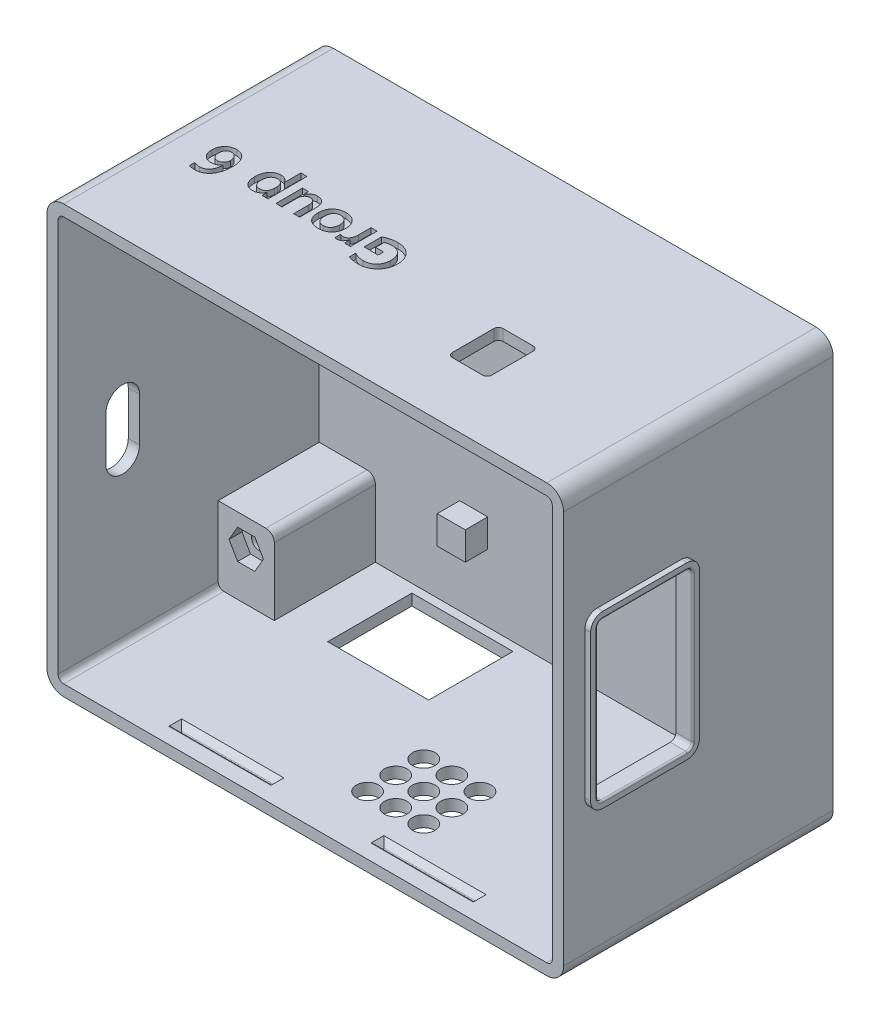
from build123d import *

# Parameters (mm, degrees)
EXTRUDE_1_DEPTH      = 1.5
EXTRUDE_2_DEPTH      = 48
EXTRUDE_5_DEPTH      = 19.5
SKETCH_4_9_R         = 1.35
EXTRUDE_7_DEPTH      = 17.2
CUT_EXTRUDE_1_DEPTH  = 2
CUT_EXTRUDE_2_DEPTH  = 2
SKETCH_17_W          = 18
SKETCH_17_H          = 15
CUT_EXTRUDE_3_DEPTH  = 2.5
SKETCH_12_W          = 20
SKETCH_12_H          = 4
CUT_EXTRUDE_4_DEPTH  = 1.1
CHAMFER_30_SIZE      = 2
CHAMFER_31_SIZE      = 2
CHAMFER_32_SIZE      = 2
CHAMFER_33_SIZE      = 2
FILLET_32_R          = 0.2
FILLET_33_R          = 0.2
FILLET_34_R          = 0.2
FILLET_35_R          = 0.2
SKETCH_18_R          = 2
CUT_EXTRUDE_6_DEPTH  = 3
CUT_EXTRUDE_7_DEPTH  = 5
EXTRUDE_START        = 1
EXTRUDE_8_DEPTH      = 1
FILLET_36_R          = 0.3
CUT_EXTRUDE_14_DEPTH = 1
SKETCH_31_W          = 5
SKETCH_31_H          = 5
EXTRUDE_9_DEPTH      = 4
FILLET_37_R          = 0.3
FILLET_38_R          = 0.3
FILLET_39_R          = 0.3
FILLET_40_R          = 0.3


with BuildPart() as part:
    # 草图1 → 凸台-拉伸1 (new body)
    with BuildSketch(Plane.XY):
        with BuildLine():
            Line((3, 0), (89, 0))
            ThreePointArc((89, 0), (91.121320344, 0.878679656), (92, 3))
            Line((92, 3), (92, 73))
            ThreePointArc((92, 73), (91.121320344, 75.121320344), (89, 76))
            Line((89, 76), (3, 76))
            ThreePointArc((3, 76), (0.878679656, 75.121320344), (0, 73))
            Line((0, 73), (0, 3))
            ThreePointArc((0, 3), (0.878679656, 0.878679656), (3, 0))
        make_face()
    extrude(amount=EXTRUDE_1_DEPTH)

    # 草图3 → 凸台-拉伸2 (add)
    with BuildSketch(Plane.XY):
        with BuildLine():
            Line((3, 0), (89, 0))
            ThreePointArc((89, 0), (91.121320344, 0.878679656), (92, 3))
            Line((92, 3), (92, 73))
            ThreePointArc((92, 73), (91.121320344, 75.121320344), (89, 76))
            Line((89, 76), (3, 76))
            ThreePointArc((3, 76), (0.878679656, 75.121320344), (0, 73))
            Line((0, 73), (0, 3))
            ThreePointArc((0, 3), (0.878679656, 0.878679656), (3, 0))
        make_face()
        with BuildLine():
            Line((2, 3), (2, 73))
            ThreePointArc((2, 73), (2.292893219, 73.707106781), (3, 74))
            Line((3, 74), (89, 74))
            ThreePointArc((89, 74), (89.707106781, 73.707106781), (90, 73))
            Line((90, 73), (90, 3))
            ThreePointArc((90, 3), (89.707106781, 2.292893219), (89, 2))
            Line((89, 2), (3, 2))
            ThreePointArc((3, 2), (2.292893219, 2.292893219), (2, 3))
        make_face(mode=Mode.SUBTRACT)
    extrude(amount=EXTRUDE_2_DEPTH)

    # 草图4 → 凸台-拉伸5 (add)
    # profile 1 of 4: a face of its own
    with BuildSketch(Plane.XY):
        with BuildLine():
            Line((12, 2), (12, 14))
            ThreePointArc((12, 14), (11.560660172, 15.060660172), (10.5, 15.5))
            Line((10.5, 15.5), (2, 15.5))
            Line((2, 15.5), (2, 3))
            ThreePointArc((2, 3), (2.292893219, 2.292893219), (3, 2))
            Line((3, 2), (12, 2))
        make_face()
        Polygon((5.470021787, 13.15), (8.529978213, 13.15), (10.059956427, 10.5), (8.529978213, 7.85), (5.470021787, 7.85), (3.940043573, 10.5), align=None, mode=Mode.SUBTRACT)
    # profile 2 of 4: a face of its own
    with BuildSketch(Plane.XY):
        with BuildLine():
            Line((80, 14), (80, 2))
            Line((80, 2), (89, 2))
            ThreePointArc((89, 2), (89.707106781, 2.292893219), (90, 3))
            Line((90, 3), (90, 15.5))
            Line((90, 15.5), (81.5, 15.5))
            ThreePointArc((81.5, 15.5), (80.439339828, 15.060660172), (80, 14))
        make_face()
        Polygon((83.470021787, 7.85), (81.940043573, 10.5), (83.470021787, 13.15), (86.529978213, 13.15), (88.059956427, 10.5), (86.529978213, 7.85), align=None, mode=Mode.SUBTRACT)
    # profile 3 of 4: a face of its own
    with BuildSketch(Plane.XY):
        with BuildLine():
            Line((2, 73), (2, 63.5))
            Line((2, 63.5), (10.5, 63.5))
            ThreePointArc((10.5, 63.5), (11.560660172, 63.939339828), (12, 65))
            Line((12, 65), (12, 74))
            Line((12, 74), (3, 74))
            ThreePointArc((3, 74), (2.292893219, 73.707106781), (2, 73))
        make_face()
        Polygon((10.059956427, 68.5), (8.529978213, 65.85), (5.470021787, 65.85), (3.940043573, 68.5), (5.470021787, 71.15), (8.529978213, 71.15), align=None, mode=Mode.SUBTRACT)
    # profile 4 of 4: a face of its own
    with BuildSketch(Plane.XY):
        with BuildLine():
            Line((81.5, 63.5), (90, 63.5))
            Line((90, 63.5), (90, 73))
            ThreePointArc((90, 73), (89.707106781, 73.707106781), (89, 74))
            Line((89, 74), (80, 74))
            Line((80, 74), (80, 65))
            ThreePointArc((80, 65), (80.439339828, 63.939339828), (81.5, 63.5))
        make_face()
        Polygon((86.529978213, 71.15), (88.059956427, 68.5), (86.529978213, 65.85), (83.470021787, 65.85), (81.940043573, 68.5), (83.470021787, 71.15), align=None, mode=Mode.SUBTRACT)
    extrude(amount=EXTRUDE_5_DEPTH)

    # 草图4<9> → 凸台-拉伸7 (add)
    # profile 1 of 4: a face of its own
    with BuildSketch(Plane.XY):
        Polygon((86.529978213, 65.85), (83.470021787, 65.85), (81.940043573, 68.5), (83.470021787, 71.15), (86.529978213, 71.15), (88.059956427, 68.5), align=None)
        with Locations(Location((85, 68.5, 0), (0, 0, 180))):
            Circle(SKETCH_4_9_R, mode=Mode.SUBTRACT)
    # profile 2 of 4: a face of its own
    with BuildSketch(Plane.XY):
        Polygon((86.529978213, 13.15), (83.470021787, 13.15), (81.940043573, 10.5), (83.470021787, 7.85), (86.529978213, 7.85), (88.059956427, 10.5), align=None)
        with Locations(Location((85, 10.5, 0), (0, 0, 180))):
            Circle(SKETCH_4_9_R, mode=Mode.SUBTRACT)
    # profile 3 of 4: a face of its own
    with BuildSketch(Plane.XY):
        Polygon((8.529978213, 7.85), (5.470021787, 7.85), (3.940043573, 10.5), (5.470021787, 13.15), (8.529978213, 13.15), (10.059956427, 10.5), align=None)
        with Locations(Location((7, 10.5, 0), (0, 0, 180))):
            Circle(SKETCH_4_9_R, mode=Mode.SUBTRACT)
    # profile 4 of 4: a face of its own
    with BuildSketch(Plane.XY):
        Polygon((3.940043573, 68.5), (5.470021787, 65.85), (8.529978213, 65.85), (10.059956427, 68.5), (8.529978213, 71.15), (5.470021787, 71.15), align=None)
        with Locations(Location((7, 68.5, 0), (0, 0, 180))):
            Circle(SKETCH_4_9_R, mode=Mode.SUBTRACT)
    extrude(amount=EXTRUDE_7_DEPTH)

    # 草图10 → 切除-拉伸1 (cut)
    with BuildSketch(Plane(origin=(92, 0, 0), x_dir=(0, 0, -1), z_dir=(1, 0, 0))):
        with BuildLine():
            Line((-42, 54), (-27, 54))
            ThreePointArc((-27, 54), (-26.292893219, 53.707106781), (-26, 53))
            Line((-26, 53), (-26, 27))
            ThreePointArc((-26, 27), (-26.292893219, 26.292893219), (-27, 26))
            Line((-27, 26), (-42, 26))
            ThreePointArc((-42, 26), (-42.707106781, 26.292893219), (-43, 27))
            Line((-43, 27), (-43, 53))
            ThreePointArc((-43, 53), (-42.707106781, 53.707106781), (-42, 54))
        make_face()
    extrude(amount=-CUT_EXTRUDE_1_DEPTH, mode=Mode.SUBTRACT)

    # 草图11 → 切除-拉伸2 (cut)
    with BuildSketch(Plane.ZY):
        with BuildLine():
            Line((39.5, 38.9), (39.5, 31.1))
            ThreePointArc((39.5, 31.1), (36.5, 28.1), (33.5, 31.1))
            Line((33.5, 31.1), (33.5, 38.9))
            ThreePointArc((33.5, 38.9), (36.5, 41.9), (39.5, 38.9))
        make_face()
    extrude(amount=-CUT_EXTRUDE_2_DEPTH, mode=Mode.SUBTRACT)

    # 草图17 → 切除-拉伸3 (cut)
    with BuildSketch(Plane.XZ):
        with Locations((29, 10.5)):
            Rectangle(SKETCH_17_W, SKETCH_17_H)
    extrude(amount=-CUT_EXTRUDE_3_DEPTH, mode=Mode.SUBTRACT)

    # 草图12 → 切除-拉伸4 (cut)
    with BuildSketch(Plane.XZ.offset(-74)):
        with Locations((28, 44)):
            Rectangle(SKETCH_12_W, SKETCH_12_H)
        with Locations((64, 44)):
            Rectangle(SKETCH_12_W, SKETCH_12_H)
    cut_extrude_4 = extrude(amount=-CUT_EXTRUDE_4_DEPTH, mode=Mode.SUBTRACT)

    # 倒角30
    # the kernel refuses this chamfer: 2 mm, written as the material it adds along each edge
    with BuildSketch(Plane(origin=(12.856634024, 75.1, 46), x_dir=(0, -0.9996219169112968, 0.02749587661058555), z_dir=(1, 0, 0))) as chamfer_30_piece_1_section:
        Polygon((CHAMFER_30_SIZE * 0.999621916911, CHAMFER_30_SIZE * 0.0274958766106), (-CHAMFER_30_SIZE * 0.0274958766106, CHAMFER_30_SIZE * 0.999621916911), (0, 0), align=None)
    chamfer_30_piece_1 = extrude(amount=30.286731952, mode=Mode.PRIVATE)
    chamfer_30_piece_1 = split(chamfer_30_piece_1, bisect_by=Plane(origin=(15.428317012, 74, 45.232135852), z_dir=(0, 1, 0)), keep=Keep.TOP, mode=Mode.PRIVATE)
    add(chamfer_30_piece_1)
    with BuildSketch(Plane(origin=(38, 75.1, 46), x_dir=(0.02749587661058555, -0.9996219169112968, 0), z_dir=(0, 0, -1))) as chamfer_30_piece_2_section:
        Polygon((CHAMFER_30_SIZE * 0.999621916911, CHAMFER_30_SIZE * 0.0274958766106), (-CHAMFER_30_SIZE * 0.0274958766106, CHAMFER_30_SIZE * 0.999621916911), (0, 0), align=None)
    chamfer_30_piece_2 = extrude(amount=9.143365976, mode=Mode.PRIVATE)
    chamfer_30_piece_2 = split(chamfer_30_piece_2, bisect_by=Plane(origin=(37.232135852, 74, 44), z_dir=(0, 1, 0)), keep=Keep.TOP, mode=Mode.PRIVATE)
    add(chamfer_30_piece_2)
    with BuildSketch(Plane(origin=(43.143365976, 75.1, 42), x_dir=(0, -0.9996219169112968, -0.02749587661058555), z_dir=(-1, 0, 0))) as chamfer_30_piece_3_section:
        Polygon((CHAMFER_30_SIZE * 0.999621916911, CHAMFER_30_SIZE * 0.0274958766106), (-CHAMFER_30_SIZE * 0.0274958766106, CHAMFER_30_SIZE * 0.999621916911), (0, 0), align=None)
    chamfer_30_piece_3 = extrude(amount=30.286731952, mode=Mode.PRIVATE)
    chamfer_30_piece_3 = split(chamfer_30_piece_3, bisect_by=Plane(origin=(40.571682988, 74, 42.767864148), z_dir=(0, 1, 0)), keep=Keep.TOP, mode=Mode.PRIVATE)
    add(chamfer_30_piece_3)
    with BuildSketch(Plane(origin=(18, 75.1, 36.856634024), x_dir=(-0.02749587661058555, -0.9996219169112968, 0), z_dir=(0, 0, 1))) as chamfer_30_piece_4_section:
        Polygon((CHAMFER_30_SIZE * 0.999621916911, CHAMFER_30_SIZE * 0.0274958766106), (-CHAMFER_30_SIZE * 0.0274958766106, CHAMFER_30_SIZE * 0.999621916911), (0, 0), align=None)
    chamfer_30_piece_4 = extrude(amount=9.143365976, mode=Mode.PRIVATE)
    chamfer_30_piece_4 = split(chamfer_30_piece_4, bisect_by=Plane(origin=(18.767864148, 74, 39.428317012), z_dir=(0, 1, 0)), keep=Keep.TOP, mode=Mode.PRIVATE)
    add(chamfer_30_piece_4)

    # 倒角31
    # the kernel refuses this chamfer: 2 mm, written as the material it adds along each edge
    with BuildSketch(Plane(origin=(48.856634024, 75.1, 46), x_dir=(0, -0.9996219169112968, 0.02749587661058555), z_dir=(1, 0, 0))) as chamfer_31_piece_1_section:
        Polygon((CHAMFER_31_SIZE * 0.999621916911, CHAMFER_31_SIZE * 0.0274958766106), (-CHAMFER_31_SIZE * 0.0274958766106, CHAMFER_31_SIZE * 0.999621916911), (0, 0), align=None)
    chamfer_31_piece_1 = extrude(amount=30.286731952, mode=Mode.PRIVATE)
    chamfer_31_piece_1 = split(chamfer_31_piece_1, bisect_by=Plane(origin=(51.428317012, 74, 45.232135852), z_dir=(0, 1, 0)), keep=Keep.TOP, mode=Mode.PRIVATE)
    add(chamfer_31_piece_1)
    with BuildSketch(Plane(origin=(74, 75.1, 46), x_dir=(0.027495876610589005, -0.9996219169112968, 0), z_dir=(0, 0, -1))) as chamfer_31_piece_2_section:
        Polygon((CHAMFER_31_SIZE * 0.999621916911, CHAMFER_31_SIZE * 0.0274958766106), (-CHAMFER_31_SIZE * 0.0274958766106, CHAMFER_31_SIZE * 0.999621916911), (0, 0), align=None)
    chamfer_31_piece_2 = extrude(amount=9.143365976, mode=Mode.PRIVATE)
    chamfer_31_piece_2 = split(chamfer_31_piece_2, bisect_by=Plane(origin=(73.232135852, 74, 44), z_dir=(0, 1, 0)), keep=Keep.TOP, mode=Mode.PRIVATE)
    add(chamfer_31_piece_2)
    with BuildSketch(Plane(origin=(79.143365976, 75.1, 42), x_dir=(0, -0.9996219169112968, -0.02749587661058555), z_dir=(-1, 0, 0))) as chamfer_31_piece_3_section:
        Polygon((CHAMFER_31_SIZE * 0.999621916911, CHAMFER_31_SIZE * 0.0274958766106), (-CHAMFER_31_SIZE * 0.0274958766106, CHAMFER_31_SIZE * 0.999621916911), (0, 0), align=None)
    chamfer_31_piece_3 = extrude(amount=30.286731952, mode=Mode.PRIVATE)
    chamfer_31_piece_3 = split(chamfer_31_piece_3, bisect_by=Plane(origin=(76.571682988, 74, 42.767864148), z_dir=(0, 1, 0)), keep=Keep.TOP, mode=Mode.PRIVATE)
    add(chamfer_31_piece_3)
    with BuildSketch(Plane(origin=(54, 75.1, 36.856634024), x_dir=(-0.02749587661058555, -0.9996219169112968, 0), z_dir=(0, 0, 1))) as chamfer_31_piece_4_section:
        Polygon((CHAMFER_31_SIZE * 0.999621916911, CHAMFER_31_SIZE * 0.0274958766106), (-CHAMFER_31_SIZE * 0.0274958766106, CHAMFER_31_SIZE * 0.999621916911), (0, 0), align=None)
    chamfer_31_piece_4 = extrude(amount=9.143365976, mode=Mode.PRIVATE)
    chamfer_31_piece_4 = split(chamfer_31_piece_4, bisect_by=Plane(origin=(54.767864148, 74, 39.428317012), z_dir=(0, 1, 0)), keep=Keep.TOP, mode=Mode.PRIVATE)
    add(chamfer_31_piece_4)

    # 镜向6: 切除-拉伸4 across plane
    add(cut_extrude_4.mirror(Plane(origin=(0, 38, 0), x_dir=(0, 0, 1), z_dir=(0, -1, 0))), mode=Mode.SUBTRACT)

    # 倒角32
    # the kernel refuses this chamfer: 2 mm, written as the material it adds along each edge
    with BuildSketch(Plane(origin=(79.143365976, 0.9, 42), x_dir=(0, 0.9996219169112968, -0.02749587661058563), z_dir=(-1, 0, 0))) as chamfer_32_piece_1_section:
        Polygon((CHAMFER_32_SIZE * 0.999621916911, -CHAMFER_32_SIZE * 0.0274958766106), (-CHAMFER_32_SIZE * 0.0274958766106, -CHAMFER_32_SIZE * 0.999621916911), (0, 0), align=None)
    chamfer_32_piece_1 = extrude(amount=30.286731952, mode=Mode.PRIVATE)
    chamfer_32_piece_1 = split(chamfer_32_piece_1, bisect_by=Plane(origin=(76.571682988, 2, 42.767864148), z_dir=(0, -1, 0)), keep=Keep.TOP, mode=Mode.PRIVATE)
    add(chamfer_32_piece_1)
    with BuildSketch(Plane(origin=(74, 0.9, 46), x_dir=(0.02749587661058908, 0.9996219169112968, 0), z_dir=(0, 0, -1))) as chamfer_32_piece_2_section:
        Polygon((CHAMFER_32_SIZE * 0.999621916911, -CHAMFER_32_SIZE * 0.0274958766106), (-CHAMFER_32_SIZE * 0.0274958766106, -CHAMFER_32_SIZE * 0.999621916911), (0, 0), align=None)
    chamfer_32_piece_2 = extrude(amount=9.143365976, mode=Mode.PRIVATE)
    chamfer_32_piece_2 = split(chamfer_32_piece_2, bisect_by=Plane(origin=(73.232135852, 2, 44), z_dir=(0, -1, 0)), keep=Keep.TOP, mode=Mode.PRIVATE)
    add(chamfer_32_piece_2)
    with BuildSketch(Plane(origin=(48.856634024, 0.9, 46), x_dir=(0, 0.9996219169112968, 0.02749587661058563), z_dir=(1, 0, 0))) as chamfer_32_piece_3_section:
        Polygon((CHAMFER_32_SIZE * 0.999621916911, -CHAMFER_32_SIZE * 0.0274958766106), (-CHAMFER_32_SIZE * 0.0274958766106, -CHAMFER_32_SIZE * 0.999621916911), (0, 0), align=None)
    chamfer_32_piece_3 = extrude(amount=30.286731952, mode=Mode.PRIVATE)
    chamfer_32_piece_3 = split(chamfer_32_piece_3, bisect_by=Plane(origin=(51.428317012, 2, 45.232135852), z_dir=(0, -1, 0)), keep=Keep.TOP, mode=Mode.PRIVATE)
    add(chamfer_32_piece_3)
    with BuildSketch(Plane(origin=(54, 0.9, 36.856634024), x_dir=(-0.02749587661058563, 0.9996219169112968, 0), z_dir=(0, 0, 1))) as chamfer_32_piece_4_section:
        Polygon((CHAMFER_32_SIZE * 0.999621916911, -CHAMFER_32_SIZE * 0.0274958766106), (-CHAMFER_32_SIZE * 0.0274958766106, -CHAMFER_32_SIZE * 0.999621916911), (0, 0), align=None)
    chamfer_32_piece_4 = extrude(amount=9.143365976, mode=Mode.PRIVATE)
    chamfer_32_piece_4 = split(chamfer_32_piece_4, bisect_by=Plane(origin=(54.767864148, 2, 39.428317012), z_dir=(0, -1, 0)), keep=Keep.TOP, mode=Mode.PRIVATE)
    add(chamfer_32_piece_4)

    # 倒角33
    # the kernel refuses this chamfer: 2 mm, written as the material it adds along each edge
    with BuildSketch(Plane(origin=(43.143365976, 0.9, 42), x_dir=(0, 0.9996219169112968, -0.02749587661058563), z_dir=(-1, 0, 0))) as chamfer_33_piece_1_section:
        Polygon((CHAMFER_33_SIZE * 0.999621916911, -CHAMFER_33_SIZE * 0.0274958766106), (-CHAMFER_33_SIZE * 0.0274958766106, -CHAMFER_33_SIZE * 0.999621916911), (0, 0), align=None)
    chamfer_33_piece_1 = extrude(amount=30.286731952, mode=Mode.PRIVATE)
    chamfer_33_piece_1 = split(chamfer_33_piece_1, bisect_by=Plane(origin=(40.571682988, 2, 42.767864148), z_dir=(0, -1, 0)), keep=Keep.TOP, mode=Mode.PRIVATE)
    add(chamfer_33_piece_1)
    with BuildSketch(Plane(origin=(38, 0.9, 46), x_dir=(0.02749587661058563, 0.9996219169112968, 0), z_dir=(0, 0, -1))) as chamfer_33_piece_2_section:
        Polygon((CHAMFER_33_SIZE * 0.999621916911, -CHAMFER_33_SIZE * 0.0274958766106), (-CHAMFER_33_SIZE * 0.0274958766106, -CHAMFER_33_SIZE * 0.999621916911), (0, 0), align=None)
    chamfer_33_piece_2 = extrude(amount=9.143365976, mode=Mode.PRIVATE)
    chamfer_33_piece_2 = split(chamfer_33_piece_2, bisect_by=Plane(origin=(37.232135852, 2, 44), z_dir=(0, -1, 0)), keep=Keep.TOP, mode=Mode.PRIVATE)
    add(chamfer_33_piece_2)
    with BuildSketch(Plane(origin=(12.856634024, 0.9, 46), x_dir=(0, 0.9996219169112968, 0.02749587661058563), z_dir=(1, 0, 0))) as chamfer_33_piece_3_section:
        Polygon((CHAMFER_33_SIZE * 0.999621916911, -CHAMFER_33_SIZE * 0.0274958766106), (-CHAMFER_33_SIZE * 0.0274958766106, -CHAMFER_33_SIZE * 0.999621916911), (0, 0), align=None)
    chamfer_33_piece_3 = extrude(amount=30.286731952, mode=Mode.PRIVATE)
    chamfer_33_piece_3 = split(chamfer_33_piece_3, bisect_by=Plane(origin=(15.428317012, 2, 45.232135852), z_dir=(0, -1, 0)), keep=Keep.TOP, mode=Mode.PRIVATE)
    add(chamfer_33_piece_3)
    with BuildSketch(Plane(origin=(18, 0.9, 36.856634024), x_dir=(-0.02749587661058563, 0.9996219169112968, 0), z_dir=(0, 0, 1))) as chamfer_33_piece_4_section:
        Polygon((CHAMFER_33_SIZE * 0.999621916911, -CHAMFER_33_SIZE * 0.0274958766106), (-CHAMFER_33_SIZE * 0.0274958766106, -CHAMFER_33_SIZE * 0.999621916911), (0, 0), align=None)
    chamfer_33_piece_4 = extrude(amount=9.143365976, mode=Mode.PRIVATE)
    chamfer_33_piece_4 = split(chamfer_33_piece_4, bisect_by=Plane(origin=(18.767864148, 2, 39.428317012), z_dir=(0, -1, 0)), keep=Keep.TOP, mode=Mode.PRIVATE)
    add(chamfer_33_piece_4)

    # 圆角32
    fillet_32_edges = [part.edges().sort_by_distance(p)[0] for p in [
        (28, 0.9, 44),
    ]]
    fillet(fillet_32_edges, radius=FILLET_32_R)

    # 圆角33
    fillet_33_edges = [part.edges().sort_by_distance(p)[0] for p in [
        (64, 0.9, 44),
    ]]
    fillet(fillet_33_edges, radius=FILLET_33_R)

    # 圆角34
    fillet_34_edges = [part.edges().sort_by_distance(p)[0] for p in [
        (64, 75.1, 44),
    ]]
    fillet(fillet_34_edges, radius=FILLET_34_R)

    # 圆角35
    fillet_35_edges = [part.edges().sort_by_distance(p)[0] for p in [
        (28, 75.1, 44),
    ]]
    fillet(fillet_35_edges, radius=FILLET_35_R)

    # 草图18 → 切除-拉伸6 (cut)
    with BuildSketch(Plane.XZ):
        with Locations(Location((46.65, 37.541037588, 0), (0, 0, 270))):
            Circle(SKETCH_18_R)
        with Locations(Location((51.65, 37.541037588, 0), (0, 0, 270))):
            Circle(SKETCH_18_R)
        with Locations(Location((46.65, 32.541037588, 0), (0, 0, 270))):
            Circle(SKETCH_18_R)
        with Locations(Location((56.65, 37.541037588, 0), (0, 0, 270))):
            Circle(SKETCH_18_R)
        with Locations(Location((46.65, 27.541037588, 0), (0, 0, 270))):
            Circle(SKETCH_18_R)
        with Locations(Location((56.65, 32.541037588, 0), (0, 0, 270))):
            Circle(SKETCH_18_R)
        with Locations(Location((51.65, 27.541037588, 0), (0, 0, 270))):
            Circle(SKETCH_18_R)
        with Locations(Location((56.65, 27.541037588, 0), (0, 0, 270))):
            Circle(SKETCH_18_R)
        with Locations(Location((51.65, 32.541037588, 0), (0, 0, 270))):
            Circle(SKETCH_18_R)
    extrude(amount=-CUT_EXTRUDE_6_DEPTH, mode=Mode.SUBTRACT)

    # 草图21 → 切除-拉伸7 (cut)
    with BuildSketch(Plane(origin=(0, 76, 0), x_dir=(1, 0, 0), z_dir=(0, 1, 0))):
        with BuildLine():
            Line((61.3, -28.1), (66.7, -28.1))
            ThreePointArc((66.7, -28.1), (67.265685425, -28.334314575), (67.5, -28.9))
            Line((67.5, -28.9), (67.5, -36.3))
            ThreePointArc((67.5, -36.3), (67.265685425, -36.865685425), (66.7, -37.1))
            Line((66.7, -37.1), (61.3, -37.1))
            ThreePointArc((61.3, -37.1), (60.734314575, -36.865685425), (60.5, -36.3))
            Line((60.5, -36.3), (60.5, -28.9))
            ThreePointArc((60.5, -28.9), (60.734314575, -28.334314575), (61.3, -28.1))
        make_face()
    extrude(amount=-CUT_EXTRUDE_7_DEPTH, mode=Mode.SUBTRACT)

    # 草图27 → 凸台-拉伸8 (add)
    with BuildSketch(Plane(origin=(92, 0, 0), x_dir=(0, 0, -1), z_dir=(1, 0, 0)).offset(EXTRUDE_START)):
        with BuildLine():
            Line((-42, 24.8), (-27, 24.8))
            ThreePointArc((-27, 24.8), (-25.444365081, 25.444365081), (-24.8, 27))
            Line((-24.8, 27), (-24.8, 53))
            ThreePointArc((-24.8, 53), (-25.444365081, 54.555634919), (-27, 55.2))
            Line((-27, 55.2), (-42, 55.2))
            ThreePointArc((-42, 55.2), (-43.555634919, 54.555634919), (-44.2, 53))
            Line((-44.2, 53), (-44.2, 27))
            ThreePointArc((-44.2, 27), (-43.555634919, 25.444365081), (-42, 24.8))
        make_face()
        with BuildLine():
            Line((-27, 54), (-42, 54))
            ThreePointArc((-42, 54), (-42.707106781, 53.707106781), (-43, 53))
            Line((-43, 53), (-43, 27))
            ThreePointArc((-43, 27), (-42.707106781, 26.292893219), (-42, 26))
            Line((-42, 26), (-27, 26))
            ThreePointArc((-27, 26), (-26.292893219, 26.292893219), (-26, 27))
            Line((-26, 27), (-26, 53))
            ThreePointArc((-26, 53), (-26.292893219, 53.707106781), (-27, 54))
        make_face(mode=Mode.SUBTRACT)
    extrude(amount=-EXTRUDE_8_DEPTH)

    # 圆角36
    fillet_36_edges = [part.edges().sort_by_distance(p)[0] for p in [
        (93, 26.292893219, 26.292893219),
        (93, 40, 26),
        (93, 53.707106781, 26.292893219),
        (93, 54, 34.5),
        (93, 53.707106781, 42.707106781),
        (93, 40, 43),
        (93, 26.292893219, 42.707106781),
        (93, 26, 34.5),
    ]]
    fillet(fillet_36_edges, radius=FILLET_36_R)

    # 草图30 → 切除-拉伸14 (cut)
    # profile 1 of 6: a face of its own
    with BuildSketch(Plane(origin=(0, 76, 0), x_dir=(1, 0, 0), z_dir=(0, 1, 0))):
        with BuildLine():
            add(Edge.make_bspline(
                [(7.837725459, -26.451702353), (7.839231395, -26.370127134), (7.842187568, -26.209993911), (7.875495868, -25.975784287), (7.9254127, -25.752108194), (7.996956665, -25.540027795), (8.088243661, -25.341303685), (8.193379509, -25.154656374), (8.316790428, -24.983793561), (8.454284076, -24.826637104), (8.606681881, -24.684281132), (8.775335908, -24.561114532), (8.956202981, -24.452991886), (9.150003974, -24.362966541), (9.354063062, -24.289220575), (9.568893712, -24.239555282), (9.791181651, -24.206179605), (9.942664393, -24.203118841), (10.019212263, -24.201572163)],
                knots=[0, 0, 0, 0, 1.114728793, 2.188227203, 3.228076612, 4.245215034, 5.242152729, 6.214694322, 7.169826888, 8.118769181, 9.066348733, 10.015043401, 10.969109421, 11.943320545, 12.932945183, 13.930138159, 14.954049072, 16, 16, 16, 16], degree=3))
            add(Edge.make_bspline(
                [(10.019212263, -24.201572163), (10.101248251, -24.204007168), (10.262454513, -24.208792116), (10.499414043, -24.244808815), (10.725271859, -24.307067628), (10.940706102, -24.392722466), (11.144907751, -24.500668382), (11.33396555, -24.635149086), (11.507918291, -24.793316995), (11.667951947, -24.973683324), (11.810856776, -25.178553461), (11.93803679, -25.406388887), (12.045076072, -25.65876895), (12.137956499, -25.932855484), (12.209451856, -26.230244181), (12.263973661, -26.550204532), (12.29274143, -26.893694586), (12.297233621, -27.130309543), (12.299545542, -27.252084233)],
                knots=[0, 0, 0, 0, 0.917785828, 1.803511187, 2.674367914, 3.533995913, 4.393089911, 5.252687405, 6.122806086, 7.018833661, 7.945123086, 8.912525681, 9.933228562, 11.008480187, 12.147389292, 13.352090246, 14.637244262, 16, 16, 16, 16], degree=3))
            add(Edge.make_bspline(
                [(12.299545542, -27.252084233), (12.297000062, -27.400902802), (12.292039772, -27.690900464), (12.251020596, -28.112794581), (12.180886748, -28.508762913), (12.085446883, -28.877901945), (11.965973945, -29.22004631), (11.824900474, -29.533360809), (11.663887707, -29.819188703), (11.481408527, -30.074970731), (11.279345344, -30.301329389), (11.06235573, -30.501313356), (10.825252543, -30.669241033), (10.573796725, -30.809860909), (10.308614835, -30.920551839), (10.0311425, -30.996308776), (9.74423435, -31.047428987), (9.548543997, -31.052407399), (9.44947216, -31.054927812)],
                knots=[0, 0, 0, 0, 1.341402564, 2.613945368, 3.816495234, 4.963196911, 6.047434463, 7.079561533, 8.056907809, 9.000227372, 9.90605979, 10.787978153, 11.6545661, 12.518872876, 13.380773975, 14.237595208, 15.107750182, 16, 16, 16, 16], degree=3))
            add(Edge.make_bspline(
                [(9.44947216, -31.054927812), (9.388597163, -31.054503576), (9.269054794, -31.053670487), (9.094054304, -31.044124972), (8.926974821, -31.027233399), (8.769759732, -31.006080591), (8.623933324, -30.978945561), (8.492887658, -30.946234195), (8.376422984, -30.910017044), (8.30611898, -30.879758717), (8.272924525, -30.865472067)],
                knots=[0, 0, 0, 0, 1.217696655, 2.391233695, 3.504371771, 4.576356939, 5.563864047, 6.46975115, 7.277483882, 8, 8, 8, 8], degree=3))
            Line((8.272924525, -30.865472067), (8.272924525, -29.903091797))
            add(Edge.make_bspline(
                [(8.272924525, -29.903091797), (8.353847257, -29.939608338), (8.518029876, -30.013696065), (8.734387994, -30.087538141), (8.918820995, -30.133545269), (9.068978992, -30.157683074), (9.228578555, -30.173079028), (9.338232696, -30.175201994), (9.394557451, -30.176292473)],
                knots=[0, 0, 0, 0, 1.371310968, 2.782227202, 3.524793152, 4.305945702, 5.129835019, 6, 6, 6, 6], degree=3))
            add(Edge.make_bspline(
                [(9.394557451, -30.176292473), (9.458269605, -30.174482004), (9.583620872, -30.170919975), (9.768071168, -30.141598479), (9.943984926, -30.091477379), (10.113371451, -30.024643926), (10.271816317, -29.935854304), (10.421952553, -29.831747728), (10.558082001, -29.706402181), (10.683679892, -29.564570087), (10.796476329, -29.40411356), (10.896694002, -29.225968394), (10.984740078, -29.030348896), (11.058411364, -28.816563716), (11.118925062, -28.585883945), (11.1626535, -28.338005017), (11.188233278, -28.073582812), (11.19320421, -27.89189571), (11.195759897, -27.798485585)],
                knots=[0, 0, 0, 0, 0.91345473, 1.797187828, 2.669884559, 3.532777489, 4.402309398, 5.269062608, 6.147196755, 7.049262513, 7.981620723, 8.954451378, 9.976726088, 11.054007273, 12.193831509, 13.393749127, 14.660057773, 16, 16, 16, 16], degree=3))
            Line((11.195759897, -27.798485585), (11.168302543, -27.798485585))
            add(Edge.make_bspline(
                [(11.168302543, -27.798485585), (11.131239818, -27.851296346), (11.057133069, -27.956891223), (10.920651505, -28.096052349), (10.765146681, -28.217526958), (10.592492162, -28.322246292), (10.40139291, -28.405112212), (10.193648754, -28.463712851), (9.970138411, -28.499995678), (9.815711816, -28.50454757), (9.736401513, -28.506885327)],
                knots=[0, 0, 0, 0, 0.927131133, 1.85379449, 2.791689413, 3.76059972, 4.751457081, 5.778941232, 6.859310183, 8, 8, 8, 8], degree=3))
            add(Edge.make_bspline(
                [(9.736401513, -28.506885327), (9.665356764, -28.505688776), (9.526818033, -28.503355477), (9.324409486, -28.47385108), (9.132191044, -28.431563811), (8.951292288, -28.368709038), (8.781668707, -28.291366772), (8.626137477, -28.194775044), (8.480359591, -28.087050435), (8.349858003, -27.960843739), (8.232113796, -27.820518346), (8.131092747, -27.663636), (8.040809774, -27.494375829), (7.966777185, -27.309817726), (7.910134496, -27.111762832), (7.866819563, -26.902199147), (7.842348655, -26.680640361), (7.839288408, -26.529098712), (7.837725459, -26.451702353)],
                knots=[0, 0, 0, 0, 1.077569448, 2.101282756, 3.098925121, 4.06115902, 5.0029132, 5.922683519, 6.835501741, 7.749376711, 8.671740557, 9.610080852, 10.576518415, 11.580141092, 12.622169819, 13.699828833, 14.825241299, 16, 16, 16, 16], degree=3))
        make_face()
        with BuildLine():
            add(Edge.make_bspline(
                [(8.920918088, -26.35148301), (8.921713668, -26.398181053), (8.923268751, -26.489459486), (8.935306908, -26.62357557), (8.9580544, -26.750788112), (8.98551314, -26.872114286), (9.024882693, -26.985211271), (9.070623635, -27.09098372), (9.126668748, -27.188014549), (9.189229675, -27.277822012), (9.262126317, -27.358277937), (9.345802703, -27.426323425), (9.435467305, -27.488075024), (9.535007777, -27.539017601), (9.643926648, -27.578616457), (9.761321848, -27.607135616), (9.887281162, -27.625777219), (9.974295242, -27.627408114), (10.019212263, -27.628249988)],
                knots=[0, 0, 0, 0, 1.171909217, 2.290674915, 3.374409661, 4.413409255, 5.408512558, 6.375177489, 7.301074568, 8.215577101, 9.117883784, 10.0148394, 10.916268638, 11.845932865, 12.812393116, 13.817912492, 14.873597588, 16, 16, 16, 16], degree=3))
            add(Edge.make_bspline(
                [(10.019212263, -27.628249988), (10.064096991, -27.626691142), (10.151934674, -27.62364054), (10.279418613, -27.606970416), (10.397697997, -27.5739943), (10.508139716, -27.532157609), (10.609165203, -27.477603468), (10.703441266, -27.417889901), (10.787810585, -27.348320116), (10.86345707, -27.271228779), (10.930540558, -27.187185542), (10.990467715, -27.097735978), (11.039480672, -27.001604289), (11.09211863, -26.867188362), (11.140515752, -26.692391704), (11.147153353, -26.548161859), (11.150455262, -26.476413972)],
                knots=[0, 0, 0, 0, 1.04389482, 2.042861946, 2.979623477, 3.892337154, 4.782197976, 5.643822534, 6.482888779, 7.317898928, 8.150262014, 8.979355577, 9.81673417, 10.652353988, 12.334696086, 14, 14, 14, 14], degree=3))
            add(Edge.make_bspline(
                [(11.150455262, -26.476413972), (11.147230589, -26.396999934), (11.140643448, -26.234778428), (11.096565358, -26.03413919), (11.046533147, -25.8753233), (10.999925772, -25.759298478), (10.943426333, -25.648997617), (10.877374242, -25.54497379), (10.803836273, -25.446867533), (10.719482854, -25.358446751), (10.625059515, -25.279974319), (10.522480132, -25.209500317), (10.409313995, -25.150583177), (10.284578096, -25.109979179), (10.150208748, -25.084554886), (10.057313297, -25.081682672), (10.009602189, -25.080207503)],
                knots=[0, 0, 0, 0, 1.658502323, 3.387873839, 4.271058063, 5.137724898, 5.997451292, 6.857124491, 7.710229292, 8.555795781, 9.404385631, 10.271790907, 11.152901439, 12.060197367, 13.003717276, 14, 14, 14, 14], degree=3))
            add(Edge.make_bspline(
                [(10.009602189, -25.080207503), (9.966950126, -25.080938965), (9.883469321, -25.08237062), (9.762219855, -25.103060293), (9.647570924, -25.132117593), (9.541676521, -25.175531947), (9.443448333, -25.227653576), (9.353602561, -25.289860461), (9.271974401, -25.361682384), (9.199325823, -25.443204867), (9.134490355, -25.532235066), (9.07953141, -25.630570569), (9.029712611, -25.735055592), (8.990773197, -25.848156546), (8.958522284, -25.966339986), (8.937385664, -26.090509094), (8.922810558, -26.219339355), (8.921554411, -26.307051154), (8.920918088, -26.35148301)],
                knots=[0, 0, 0, 0, 1.084422265, 2.122486895, 3.122800693, 4.089794635, 5.02793783, 5.948926211, 6.865112935, 7.789043778, 8.723490771, 9.662718316, 10.652941449, 11.666196107, 12.703279733, 13.768190844, 14.869440339, 16, 16, 16, 16], degree=3))
        make_face(mode=Mode.SUBTRACT)
    # profile 2 of 6: a face of its own
    with BuildSketch(Plane(origin=(0, 76, 0), x_dir=(1, 0, 0), z_dir=(0, 1, 0))):
        with BuildLine():
            Line((19.325882524, -25.039021471), (19.343729804, -25.039021471))
            Line((19.343729804, -25.039021471), (19.343729804, -22.092847348))
            Line((19.343729804, -22.092847348), (20.418685227, -22.092847348))
            Line((20.418685227, -22.092847348), (20.418685227, -29.034066531))
            Line((20.418685227, -29.034066531), (19.343729804, -29.034066531))
            Line((19.343729804, -29.034066531), (19.343729804, -28.155431191))
            Line((19.343729804, -28.155431191), (19.325882524, -28.155431191))
            add(Edge.make_bspline(
                [(19.325882524, -28.155431191), (19.279228724, -28.232210789), (19.188470165, -28.38157495), (19.024612068, -28.579307392), (18.845321492, -28.747176248), (18.649966616, -28.884649461), (18.438441543, -28.992258889), (18.210163156, -29.067102181), (17.966354374, -29.11383135), (17.798553831, -29.119190241), (17.712762955, -29.121930065)],
                knots=[0, 0, 0, 0, 1.087937529, 2.116433017, 3.101648893, 4.057389971, 5.002624612, 5.96746697, 6.960832977, 8, 8, 8, 8], degree=3))
            add(Edge.make_bspline(
                [(17.712762955, -29.121930065), (17.639425944, -29.120318163), (17.496213244, -29.117170436), (17.287891218, -29.085813416), (17.092021371, -29.037207079), (16.908877425, -28.967574254), (16.737296366, -28.879769471), (16.578771203, -28.770646639), (16.433192396, -28.641065713), (16.300524345, -28.49326059), (16.182816164, -28.32783028), (16.079535012, -28.149129625), (15.992642912, -27.956306353), (15.921426965, -27.750463328), (15.866897076, -27.53072234), (15.827146382, -27.29858591), (15.803750202, -27.052582665), (15.800602966, -26.884206623), (15.798985356, -26.797665018)],
                knots=[0, 0, 0, 0, 1.03437162, 2.019923519, 2.966065333, 3.877718498, 4.778971363, 5.680085363, 6.586000907, 7.523572761, 8.477092696, 9.446427435, 10.432085142, 11.457444532, 12.516366817, 13.623831319, 14.778701243, 16, 16, 16, 16], degree=3))
            add(Edge.make_bspline(
                [(15.798985356, -26.797665018), (15.800230227, -26.701943617), (15.802665887, -26.514659368), (15.831461056, -26.241836469), (15.874266446, -25.982659144), (15.937547912, -25.738974311), (16.017332466, -25.509154102), (16.114365512, -25.293745516), (16.232033476, -25.094460121), (16.364735328, -24.909657978), (16.514000116, -24.744041406), (16.676848576, -24.598139645), (16.853716435, -24.475607594), (17.042712883, -24.374181497), (17.245648974, -24.297537516), (17.460756835, -24.240659963), (17.689775918, -24.207662486), (17.846741079, -24.20363149), (17.926930319, -24.201572163)],
                knots=[0, 0, 0, 0, 1.213889653, 2.375042679, 3.476488291, 4.54385188, 5.56472972, 6.559809165, 7.535614661, 8.496013796, 9.441504295, 10.358528091, 11.263639099, 12.164887555, 13.072731554, 14.009177346, 14.982942744, 16, 16, 16, 16], degree=3))
            add(Edge.make_bspline(
                [(17.926930319, -24.201572163), (18.000761701, -24.204337119), (18.144883633, -24.209734427), (18.354582346, -24.248184147), (18.549936077, -24.315363419), (18.73368953, -24.406326315), (18.903556753, -24.525740233), (19.059454958, -24.672076867), (19.203858977, -24.842950967), (19.284458483, -24.972460282), (19.325882524, -25.039021471)],
                knots=[0, 0, 0, 0, 1.033447623, 2.017332805, 2.971569682, 3.917056367, 4.878577601, 5.866812548, 6.903650321, 8, 8, 8, 8], degree=3))
        make_face()
        with BuildLine():
            Line((19.353339878, -26.858071198), (19.353339878, -26.285585359))
            add(Edge.make_bspline(
                [(19.353339878, -26.285585359), (19.352172914, -26.24436178), (19.349870027, -26.163011093), (19.334999513, -26.043346957), (19.308387074, -25.929130694), (19.273306036, -25.818999838), (19.223867616, -25.715312181), (19.168351368, -25.614098603), (19.10047087, -25.518895991), (19.022090356, -25.430858521), (18.938109379, -25.347892282), (18.845776148, -25.277047562), (18.749108036, -25.215737322), (18.64650522, -25.165791998), (18.537730296, -25.127477666), (18.423607548, -25.100281744), (18.304073226, -25.083117356), (18.222614293, -25.081192795), (18.180910847, -25.080207503)],
                knots=[0, 0, 0, 0, 1.053863336, 2.079695817, 3.075748431, 4.048657304, 5.027455849, 6.00688333, 6.99687248, 8.008195337, 9.017486472, 10.009615842, 10.976811423, 11.939468817, 12.919943627, 13.918671686, 14.93445003, 16, 16, 16, 16], degree=3))
            add(Edge.make_bspline(
                [(18.180910847, -25.080207503), (18.13229738, -25.081283836), (18.037290415, -25.083387351), (17.899499697, -25.106874471), (17.769040299, -25.140051804), (17.646945918, -25.190465547), (17.532808701, -25.254738801), (17.42750709, -25.334544822), (17.329545636, -25.426754218), (17.240510269, -25.532885917), (17.16027978, -25.651285593), (17.092668953, -25.782359862), (17.032535212, -25.923291368), (16.985162797, -26.076121044), (16.948046652, -26.240004427), (16.922744468, -26.415390762), (16.905649617, -26.601465676), (16.90374536, -26.729438804), (16.902771001, -26.794919283)],
                knots=[0, 0, 0, 0, 0.966522016, 1.888907113, 2.774821579, 3.640800831, 4.509553672, 5.37481417, 6.263953297, 7.18174019, 8.126517397, 9.104303226, 10.112498108, 11.172554105, 12.283954689, 13.453544563, 14.697045812, 16, 16, 16, 16], degree=3))
            add(Edge.make_bspline(
                [(16.902771001, -26.794919283), (16.904029702, -26.84985842), (16.906488095, -26.95716107), (16.91965519, -27.113702959), (16.943888794, -27.261266022), (16.980597177, -27.398952563), (17.023304845, -27.528840715), (17.078836842, -27.648564063), (17.14326392, -27.759259675), (17.218088126, -27.859369754), (17.2992048, -27.950983639), (17.391773885, -28.026966342), (17.487244994, -28.096486438), (17.593221008, -28.148928151), (17.704401431, -28.192968365), (17.823966282, -28.21999546), (17.94906062, -28.241247598), (18.035286332, -28.242602716), (18.079318636, -28.243294725)],
                knots=[0, 0, 0, 0, 1.251506559, 2.444340742, 3.575319154, 4.652317473, 5.687338566, 6.68543322, 7.652568213, 8.599036514, 9.528769266, 10.430983402, 11.32162283, 12.212018248, 13.116036934, 14.038790361, 14.998482272, 16, 16, 16, 16], degree=3))
            add(Edge.make_bspline(
                [(18.079318636, -28.243294725), (18.126039898, -28.241766316), (18.217535652, -28.238773182), (18.351674789, -28.221475628), (18.477874919, -28.189290432), (18.598053462, -28.146890408), (18.710033072, -28.090287655), (18.816252379, -28.022202364), (18.914521366, -27.941258686), (19.005164058, -27.848850758), (19.087087181, -27.747804927), (19.159259517, -27.639257853), (19.217624324, -27.522882188), (19.267658422, -27.401997326), (19.306280972, -27.274645973), (19.333364215, -27.141353281), (19.350383031, -27.001746761), (19.352340555, -26.906629115), (19.353339878, -26.858071198)],
                knots=[0, 0, 0, 0, 1.062557445, 2.080840463, 3.067536494, 4.018702425, 4.972596044, 5.913462713, 6.881997822, 7.860541022, 8.851779902, 9.835839173, 10.817695734, 11.806966784, 12.807554105, 13.838043323, 14.896312951, 16, 16, 16, 16], degree=3))
        make_face(mode=Mode.SUBTRACT)
    # profile 3 of 6: a face of its own
    with BuildSketch(Plane(origin=(0, 76, 0), x_dir=(1, 0, 0), z_dir=(0, 1, 0))):
        with BuildLine():
            Line((21.816264564, -24.289435697), (22.891219987, -24.289435697))
            Line((22.891219987, -24.289435697), (22.891219987, -25.089817577))
            Line((22.891219987, -25.089817577), (22.910440135, -25.089817577))
            add(Edge.make_bspline(
                [(22.910440135, -25.089817577), (22.950241661, -25.019068703), (23.027482389, -24.881770084), (23.171120672, -24.700341731), (23.329862849, -24.545791848), (23.505896923, -24.419785055), (23.697736524, -24.32095253), (23.905838316, -24.250660073), (24.13062377, -24.208934416), (24.285872833, -24.204071821), (24.365679917, -24.201572163)],
                knots=[0, 0, 0, 0, 1.079790101, 2.095491884, 3.06967305, 4.021947572, 4.967861457, 5.933520445, 6.937708841, 8, 8, 8, 8], degree=3))
            add(Edge.make_bspline(
                [(24.365679917, -24.201572163), (24.433479422, -24.203161726), (24.5653773, -24.206254079), (24.756515672, -24.2299035), (24.935179168, -24.267774237), (25.100773135, -24.322456279), (25.252762406, -24.394207505), (25.391362161, -24.481534089), (25.517675512, -24.583865722), (25.630479343, -24.702593678), (25.730296019, -24.83705728), (25.815274929, -24.987667483), (25.886436409, -25.153673469), (25.945458476, -25.334726816), (25.992078823, -25.531658605), (26.024340397, -25.744699696), (26.043439045, -25.973136293), (26.0460814, -26.130413499), (26.047442871, -26.211450503)],
                knots=[0, 0, 0, 0, 1.084650296, 2.110090225, 3.076714774, 4.002971594, 4.893937254, 5.759411374, 6.618292969, 7.488432252, 8.373025701, 9.291288001, 10.248967678, 11.258598233, 12.334935959, 13.48348041, 14.70336451, 16, 16, 16, 16], degree=3))
            Line((26.047442871, -26.211450503), (26.047442871, -29.034066531))
            Line((26.047442871, -29.034066531), (24.972487448, -29.034066531))
            Line((24.972487448, -29.034066531), (24.972487448, -26.343245804))
            add(Edge.make_bspline(
                [(24.972487448, -26.343245804), (24.971602062, -26.292432603), (24.969877028, -26.193431146), (24.959304205, -26.0498645), (24.940302175, -25.915855426), (24.912926988, -25.792459168), (24.878550512, -25.678438101), (24.836712542, -25.574069714), (24.785315072, -25.480099744), (24.727513467, -25.39577203), (24.662558444, -25.32016189), (24.588370413, -25.255694491), (24.505949333, -25.202250673), (24.417570619, -25.155323362), (24.319929589, -25.122536258), (24.215386314, -25.096618421), (24.102849069, -25.084011888), (24.025230434, -25.081497777), (23.985395559, -25.080207503)],
                knots=[0, 0, 0, 0, 1.331982066, 2.595155638, 3.770771735, 4.87669833, 5.905024676, 6.889602643, 7.818224664, 8.70661772, 9.565361835, 10.424105951, 11.272482554, 12.136238837, 13.039171002, 13.964377818, 14.955292694, 16, 16, 16, 16], degree=3))
            add(Edge.make_bspline(
                [(23.985395559, -25.080207503), (23.946437211, -25.081214221), (23.869990141, -25.083189682), (23.757712021, -25.100222587), (23.651083388, -25.127562684), (23.548909496, -25.164743393), (23.452782122, -25.214493218), (23.362137421, -25.275435202), (23.275760793, -25.345834463), (23.197037277, -25.427839155), (23.126409147, -25.518647871), (23.061467594, -25.614706486), (23.010830334, -25.720030828), (22.965053404, -25.830264982), (22.933855752, -25.948753264), (22.907876129, -26.072733802), (22.895020515, -26.203864171), (22.892506346, -26.293344937), (22.891219987, -26.3391272)],
                knots=[0, 0, 0, 0, 0.999127095, 1.960564145, 2.906023723, 3.819897251, 4.744121092, 5.675477313, 6.618089225, 7.597919477, 8.584480182, 9.567961814, 10.565639047, 11.577312711, 12.625659834, 13.703317052, 14.82491679, 16, 16, 16, 16], degree=3))
            Line((22.891219987, -26.3391272), (22.891219987, -29.034066531))
            Line((22.891219987, -29.034066531), (21.816264564, -29.034066531))
            Line((21.816264564, -29.034066531), (21.816264564, -24.289435697))
        make_face()
    # profile 4 of 6: a face of its own
    with BuildSketch(Plane(origin=(0, 76, 0), x_dir=(1, 0, 0), z_dir=(0, 1, 0))):
        with BuildLine():
            add(Edge.make_bspline(
                [(29.474120696, -24.201572163), (29.563472515, -24.203042182), (29.738191634, -24.205916665), (29.992873613, -24.239342548), (30.234398316, -24.288165517), (30.46081779, -24.362780758), (30.675169229, -24.453267858), (30.873488372, -24.569511233), (31.060673328, -24.702002979), (31.229885404, -24.858077198), (31.383359621, -25.028797142), (31.518348158, -25.214121566), (31.630201938, -25.414377734), (31.72499438, -25.626559419), (31.795809253, -25.852998416), (31.84614616, -26.092528285), (31.879008067, -26.345080577), (31.88198488, -26.518410039), (31.883503541, -26.606836406)],
                knots=[0, 0, 0, 0, 1.115983566, 2.182201405, 3.205206547, 4.190937343, 5.156704915, 6.107298085, 7.05804609, 8.017544309, 8.977451536, 9.923560751, 10.87628499, 11.839101368, 12.823088461, 13.834905153, 14.895447613, 16, 16, 16, 16], degree=3))
            add(Edge.make_bspline(
                [(31.883503541, -26.606836406), (31.881389433, -26.703020445), (31.877280067, -26.889981301), (31.845567993, -27.162539753), (31.791678473, -27.41871995), (31.719210544, -27.660351789), (31.61966012, -27.883710769), (31.503559757, -28.092902507), (31.363789339, -28.285050345), (31.20250332, -28.458967096), (31.024714191, -28.616048687), (30.829222019, -28.750412709), (30.621360697, -28.867296507), (30.397116856, -28.960382856), (30.15844638, -29.033174307), (29.904808713, -29.085345643), (29.636376797, -29.115192445), (29.452686004, -29.119651168), (29.358799807, -29.121930065)],
                knots=[0, 0, 0, 0, 1.143824117, 2.223345344, 3.257727174, 4.254538702, 5.217243482, 6.160378323, 7.095564194, 8.035426655, 8.976517592, 9.911117243, 10.851594142, 11.807861419, 12.792668405, 13.815283976, 14.883369844, 16, 16, 16, 16], degree=3))
            add(Edge.make_bspline(
                [(29.358799807, -29.121930065), (29.268560911, -29.120278679), (29.092582043, -29.117058237), (28.83662519, -29.086447024), (28.595706563, -29.035847819), (28.370321747, -28.964606474), (28.159665226, -28.873783211), (27.964689359, -28.762021999), (27.785614416, -28.629198764), (27.621186378, -28.4781568), (27.476228814, -28.307315714), (27.348743464, -28.121404448), (27.24303774, -27.918547784), (27.154477289, -27.701441311), (27.088102174, -27.467285701), (27.038359668, -27.218608514), (27.00962065, -26.953931848), (27.006124006, -26.772564796), (27.004331671, -26.679598395)],
                knots=[0, 0, 0, 0, 1.124362069, 2.192668287, 3.207323553, 4.188646195, 5.13382991, 6.061328194, 6.983091241, 7.907409631, 8.837884658, 9.769704845, 10.711181097, 11.683511284, 12.687157073, 13.739771114, 14.841435946, 16, 16, 16, 16], degree=3))
            add(Edge.make_bspline(
                [(27.004331671, -26.679598395), (27.006430957, -26.587980144), (27.010527106, -26.409213609), (27.042736989, -26.148260604), (27.094936867, -25.901115575), (27.166470628, -25.667198909), (27.262872348, -25.448348687), (27.378249187, -25.242900218), (27.514569515, -25.051092286), (27.671764033, -24.875524006), (27.845162468, -24.716058044), (28.035646548, -24.578187576), (28.241022896, -24.462382815), (28.459594635, -24.365763273), (28.693010569, -24.291549666), (28.940526803, -24.240004098), (29.202358338, -24.207748599), (29.382042218, -24.203664862), (29.474120696, -24.201572163)],
                knots=[0, 0, 0, 0, 1.113387789, 2.172454471, 3.19032948, 4.180843377, 5.139869047, 6.091315159, 7.040563614, 7.994007627, 8.950772202, 9.898748577, 10.845353108, 11.811706805, 12.798590485, 13.816465494, 14.881054143, 16, 16, 16, 16], degree=3))
        make_face()
        with BuildLine():
            add(Edge.make_bspline(
                [(29.42332459, -28.243294725), (29.474629411, -28.241899002), (29.574409878, -28.239184521), (29.720507179, -28.220273344), (29.857809102, -28.185416255), (29.98731635, -28.139083293), (30.10888812, -28.07940748), (30.221080158, -28.005189978), (30.325269668, -27.917309578), (30.421253871, -27.817212124), (30.507584602, -27.705019379), (30.581716441, -27.581671411), (30.645760019, -27.449205415), (30.695784147, -27.305680335), (30.735708022, -27.15278426), (30.764162511, -26.989795671), (30.782628038, -26.816853407), (30.784334923, -26.697952748), (30.785209366, -26.637039495)],
                knots=[0, 0, 0, 0, 1.034448134, 2.011852193, 2.962944846, 3.885271098, 4.780713592, 5.686648249, 6.590418859, 7.523619324, 8.477750619, 9.438284955, 10.42051144, 11.439035105, 12.497604419, 13.603492488, 14.772260234, 16, 16, 16, 16], degree=3))
            add(Edge.make_bspline(
                [(30.785209366, -26.637039495), (30.784315228, -26.578415514), (30.782564458, -26.463626642), (30.764255821, -26.29658544), (30.735386993, -26.138732253), (30.696412579, -25.990378632), (30.643990945, -25.851832543), (30.578625245, -25.723576914), (30.503756266, -25.603774977), (30.416689134, -25.495075409), (30.320612233, -25.397456346), (30.216087904, -25.31160879), (30.102935786, -25.2401168), (29.981806621, -25.181561308), (29.853045055, -25.137128086), (29.716752163, -25.103204124), (29.572577572, -25.084414562), (29.473713854, -25.081627847), (29.42332459, -25.080207503)],
                knots=[0, 0, 0, 0, 1.204088729, 2.357669739, 3.447572433, 4.498997714, 5.504829815, 6.484571273, 7.452328786, 8.402385296, 9.339842832, 10.262040677, 11.174989334, 12.083326743, 13.020029557, 13.968689267, 14.964673236, 16, 16, 16, 16], degree=3))
            add(Edge.make_bspline(
                [(29.42332459, -25.080207503), (29.372009524, -25.081567112), (29.271755396, -25.084223378), (29.12600902, -25.103677911), (28.989357541, -25.135042161), (28.861836615, -25.178709547), (28.743837724, -25.23704093), (28.635620413, -25.308771614), (28.535120712, -25.392002543), (28.445033459, -25.488081212), (28.364351469, -25.596031078), (28.296642102, -25.716237914), (28.236771982, -25.845832915), (28.189053193, -25.986710216), (28.151982061, -26.138314455), (28.126774353, -26.300943578), (28.10954771, -26.474216235), (28.1076966, -26.593520473), (28.106744448, -26.654886776)],
                knots=[0, 0, 0, 0, 1.055440266, 2.062011242, 3.018838318, 3.935841059, 4.828404277, 5.718780325, 6.601107101, 7.506829209, 8.421896935, 9.366558979, 10.339688302, 11.354895015, 12.421195725, 13.546379389, 14.737935646, 16, 16, 16, 16], degree=3))
            add(Edge.make_bspline(
                [(28.106744448, -26.654886776), (28.107677358, -26.716712095), (28.109484541, -26.836476722), (28.126882919, -27.010644442), (28.151978398, -27.17419336), (28.189059654, -27.327163331), (28.236773299, -27.469402952), (28.296634908, -27.600375893), (28.364348581, -27.721918991), (28.444967597, -27.83131576), (28.535217581, -27.928504747), (28.634713481, -28.013708071), (28.744673305, -28.083239596), (28.8616538, -28.143503279), (28.98912456, -28.188741134), (29.126033138, -28.219734049), (29.271748891, -28.239303199), (29.372007322, -28.24194336), (29.42332459, -28.243294725)],
                knots=[0, 0, 0, 0, 1.265447105, 2.45135492, 3.580456177, 4.650804002, 5.67006512, 6.647109609, 7.595428626, 8.51369432, 9.421962895, 10.30613465, 11.187173238, 12.07969551, 12.995472156, 13.947763498, 14.949562934, 16, 16, 16, 16], degree=3))
        make_face(mode=Mode.SUBTRACT)
    # profile 5 of 6: a face of its own
    with BuildSketch(Plane(origin=(0, 76, 0), x_dir=(1, 0, 0), z_dir=(0, 1, 0))):
        with BuildLine():
            add(Edge.make_bspline(
                [(32.340668491, -27.979704124), (32.375267617, -28.00714663), (32.447008645, -28.06404846), (32.581015887, -28.116302151), (32.733842886, -28.150440371), (32.842908638, -28.153700684), (32.90079852, -28.155431191)],
                knots=[0, 0, 0, 0, 0.878983398, 1.82256547, 2.84426206, 4, 4, 4, 4], degree=3))
            add(Edge.make_bspline(
                [(32.90079852, -28.155431191), (32.939797883, -28.154172818), (33.016978455, -28.151682471), (33.129768664, -28.130027443), (33.23801238, -28.097567881), (33.340675376, -28.049872805), (33.438561792, -27.989268654), (33.531133128, -27.914434272), (33.617379333, -27.825453833), (33.699949292, -27.725482249), (33.775191939, -27.613683195), (33.839632751, -27.490439005), (33.894532582, -27.358075479), (33.940131265, -27.216317804), (33.973867398, -27.064553188), (33.998383308, -26.903560979), (34.013690363, -26.732974978), (34.015838351, -26.616021423), (34.016939975, -26.5560403)],
                knots=[0, 0, 0, 0, 0.860230297, 1.702414104, 2.526899269, 3.349649456, 4.193528287, 5.062905519, 5.970199264, 6.924855783, 7.922385325, 8.939220248, 9.989921066, 11.082622566, 12.222280784, 13.418226017, 14.675904258, 16, 16, 16, 16], degree=3))
            Line((34.016939975, -26.5560403), (34.016939975, -24.289435697))
            Line((34.016939975, -24.289435697), (35.091895398, -24.289435697))
            Line((35.091895398, -24.289435697), (35.091895398, -29.034066531))
            Line((35.091895398, -29.034066531), (34.016939975, -29.034066531))
            Line((34.016939975, -29.034066531), (34.016939975, -28.048347509))
            Line((34.016939975, -28.048347509), (33.999092694, -28.048347509))
            add(Edge.make_bspline(
                [(33.999092694, -28.048347509), (33.971469959, -28.128850012), (33.917970621, -28.284766164), (33.805123732, -28.497746548), (33.672936329, -28.684206057), (33.520854613, -28.841086151), (33.352876832, -28.966539689), (33.172051014, -29.05488441), (32.982031098, -29.112095264), (32.851317684, -29.118635675), (32.785477632, -29.121930065)],
                knots=[0, 0, 0, 0, 1.174412527, 2.274586214, 3.316821173, 4.322851225, 5.281407555, 6.197571329, 7.092120728, 8, 8, 8, 8], degree=3))
            add(Edge.make_bspline(
                [(32.785477632, -29.121930065), (32.739607366, -29.121263658), (32.65341915, -29.120011508), (32.53327064, -29.100823955), (32.428225972, -29.076481585), (32.368606175, -29.045730619), (32.340668491, -29.031320796)],
                knots=[0, 0, 0, 0, 1.198154244, 2.251279275, 3.180553942, 4, 4, 4, 4], degree=3))
            Line((32.340668491, -29.031320796), (32.340668491, -27.979704124))
        make_face()
    # profile 6 of 6: a face of its own
    with BuildSketch(Plane(origin=(0, 76, 0), x_dir=(1, 0, 0), z_dir=(0, 1, 0))):
        with BuildLine():
            add(Edge.make_bspline(
                [(36.376899582, -24.783668076), (36.464239323, -24.737325048), (36.638649813, -24.644781721), (36.90914542, -24.524830611), (37.188336595, -24.426670865), (37.473531785, -24.343253504), (37.767459818, -24.281162088), (38.06785678, -24.233229983), (38.376271302, -24.207866484), (38.583973381, -24.203683487), (38.688808819, -24.201572163)],
                knots=[0, 0, 0, 0, 0.984289242, 1.965547018, 2.942670307, 3.929056036, 4.921955611, 5.931773406, 6.956084395, 8, 8, 8, 8], degree=3))
            add(Edge.make_bspline(
                [(38.688808819, -24.201572163), (38.808857246, -24.203822112), (39.043852105, -24.208226386), (39.386937053, -24.254037377), (39.713044213, -24.324570838), (40.021956007, -24.424783856), (40.312842508, -24.554716106), (40.587233325, -24.711440661), (40.841699363, -24.900238595), (41.078753848, -25.113331223), (41.292830379, -25.35032275), (41.479507059, -25.608470904), (41.636022916, -25.886226565), (41.766321213, -26.180982904), (41.864799503, -26.49534127), (41.935391381, -26.827188725), (41.981189792, -27.177591885), (41.985569311, -27.417596245), (41.987809946, -27.540386454)],
                knots=[0, 0, 0, 0, 1.089679749, 2.133048697, 3.137405219, 4.116551399, 5.07656455, 6.026112131, 6.98038659, 7.948533768, 8.916680947, 9.875226606, 10.835599534, 11.807015038, 12.79675884, 13.821418623, 14.885401648, 16, 16, 16, 16], degree=3))
            add(Edge.make_bspline(
                [(41.987809946, -27.540386454), (41.985126446, -27.665926464), (41.979857539, -27.912417515), (41.932010053, -28.273268865), (41.854469125, -28.616987954), (41.743556762, -28.942790832), (41.603689011, -29.252150683), (41.430421043, -29.543544727), (41.226507617, -29.818078009), (40.99196007, -30.07158501), (40.735828551, -30.302878689), (40.459731309, -30.505130382), (40.165846977, -30.67398094), (39.856140655, -30.813894133), (39.529155912, -30.922986479), (39.184883148, -30.998486335), (38.82428388, -31.047181173), (38.578226134, -31.052310554), (38.452675572, -31.054927812)],
                knots=[0, 0, 0, 0, 1.077852099, 2.116304574, 3.120340314, 4.099809386, 5.067248293, 6.031215565, 7.006012435, 7.999117391, 8.99275114, 9.966049121, 10.932833051, 11.898649682, 12.880592066, 13.887593218, 14.922147901, 16, 16, 16, 16], degree=3))
            add(Edge.make_bspline(
                [(38.452675572, -31.054927812), (38.362046017, -31.053800809), (38.184777715, -31.05159643), (37.924110625, -31.036462233), (37.67438187, -31.010748849), (37.435717312, -30.973711063), (37.20803902, -30.926811419), (36.991378243, -30.871280993), (36.785270165, -30.804221303), (36.654345675, -30.749644367), (36.589694078, -30.722693824)],
                knots=[0, 0, 0, 0, 1.141447695, 2.232632572, 3.28732875, 4.302216682, 5.273209612, 6.214037284, 7.118076829, 8, 8, 8, 8], degree=3))
            Line((36.589694078, -30.722693824), (36.589694078, -29.561247735))
            add(Edge.make_bspline(
                [(36.589694078, -29.561247735), (36.654472053, -29.603537697), (36.783727796, -29.687921634), (36.989804442, -29.794890702), (37.204241825, -29.885576904), (37.427762012, -29.96005536), (37.660518462, -30.01770283), (37.902822521, -30.058546264), (38.15422361, -30.083852532), (38.324939022, -30.086889324), (38.41148954, -30.088428939)],
                knots=[0, 0, 0, 0, 0.963478688, 1.92249226, 2.888380933, 3.862115129, 4.855110141, 5.873182323, 6.921730802, 8, 8, 8, 8], degree=3))
            add(Edge.make_bspline(
                [(38.41148954, -30.088428939), (38.498094962, -30.086444095), (38.667837231, -30.082553903), (38.915928908, -30.048369668), (39.152406558, -29.995304074), (39.376863866, -29.920153048), (39.588912139, -29.821005024), (39.789976554, -29.702250963), (39.977292811, -29.558768022), (40.152838, -29.397810119), (40.311048938, -29.218477394), (40.451226057, -29.025639859), (40.567746832, -28.818929083), (40.663357655, -28.599948592), (40.737457137, -28.368044021), (40.790721908, -28.123552107), (40.822826417, -27.866150615), (40.826983602, -27.690579774), (40.829109592, -27.600792633)],
                knots=[0, 0, 0, 0, 1.06717146, 2.091602381, 3.081045825, 4.051523448, 5.003058578, 5.96184059, 6.924266914, 7.906381883, 8.893490649, 9.867356438, 10.839979635, 11.812602831, 12.808106799, 13.836088618, 14.8933731, 16, 16, 16, 16], degree=3))
            add(Edge.make_bspline(
                [(40.829109592, -27.600792633), (40.827261518, -27.508739122), (40.823657922, -27.329242112), (40.795747697, -27.067628117), (40.750876226, -26.821022972), (40.68817979, -26.58908139), (40.605844142, -26.372890465), (40.50461576, -26.172172797), (40.38662205, -25.98546411), (40.249121236, -25.815714871), (40.097003167, -25.663176847), (39.93118881, -25.529844162), (39.750999905, -25.418362423), (39.558556511, -25.325542381), (39.352090655, -25.256018427), (39.13373497, -25.20542495), (38.902144116, -25.172478102), (38.742923876, -25.169564002), (38.661351465, -25.168071037)],
                knots=[0, 0, 0, 0, 1.198650427, 2.337272802, 3.422058622, 4.460163113, 5.461856533, 6.429368961, 7.383331498, 8.33272196, 9.268281126, 10.184156647, 11.097021616, 12.022023607, 12.960615142, 13.927742015, 14.938331706, 16, 16, 16, 16], degree=3))
            add(Edge.make_bspline(
                [(38.661351465, -25.168071037), (38.605039088, -25.16881944), (38.494562658, -25.170287695), (38.331430189, -25.183136164), (38.17416144, -25.203259289), (38.022447423, -25.232281409), (37.876942912, -25.268930612), (37.737330457, -25.315010094), (37.602837504, -25.367419753), (37.517447201, -25.410395882), (37.475193757, -25.431661639)],
                knots=[0, 0, 0, 0, 1.10128271, 2.16055138, 3.198619163, 4.200995151, 5.180081335, 6.131149274, 7.075241845, 8, 8, 8, 8], degree=3))
            Line((37.475193757, -25.431661639), (37.475193757, -26.925341716))
            Line((37.475193757, -26.925341716), (38.874145961, -26.925341716))
            Line((38.874145961, -26.925341716), (38.874145961, -27.89184059))
            Line((38.874145961, -27.89184059), (36.376899582, -27.89184059))
            Line((36.376899582, -27.89184059), (36.376899582, -24.783668076))
        make_face()
    extrude(amount=-CUT_EXTRUDE_14_DEPTH, mode=Mode.SUBTRACT)

    # 草图31 → 凸台-拉伸9 (add)
    with BuildSketch(Plane.XY.offset(1.5)):
        with Locations((29.5, 16.5)):
            Rectangle(SKETCH_31_W, SKETCH_31_H)
    extrude(amount=EXTRUDE_9_DEPTH)

    # 圆角37
    fillet_37_edges = [part.edges().sort_by_distance(p)[0] for p in [
        (28, 74, 45.1),
    ]]
    fillet(fillet_37_edges, radius=FILLET_37_R)

    # 圆角38
    fillet_38_edges = [part.edges().sort_by_distance(p)[0] for p in [
        (64, 74, 45.1),
    ]]
    fillet(fillet_38_edges, radius=FILLET_38_R)

    # 圆角39
    fillet_39_edges = [part.edges().sort_by_distance(p)[0] for p in [
        (64, 2, 45.1),
    ]]
    fillet(fillet_39_edges, radius=FILLET_39_R)

    # 圆角40
    fillet_40_edges = [part.edges().sort_by_distance(p)[0] for p in [
        (28, 2, 45.1),
    ]]
    fillet(fillet_40_edges, radius=FILLET_40_R)


solid = part.part
